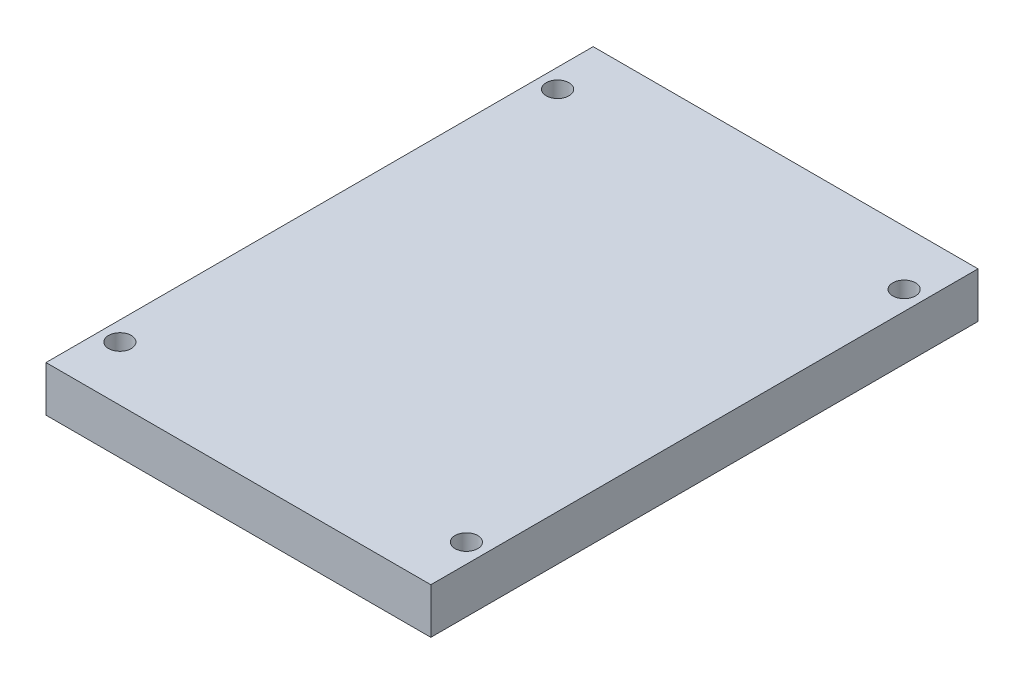
from build123d import *

# Parameters (mm, degrees)
SKETCH1_W           = 54.61
SKETCH1_H           = 76.2
BOSS_EXTRUDE1_DEPTH = 6.35
SKETCH2_R           = 1.5875
CUT_EXTRUDE1_DEPTH  = 94.962836271
SKETCH3_W           = 0.508
SKETCH3_H           = 76.2
CUT_EXTRUDE2_DEPTH  = 94.962836271


with BuildPart() as part:
    # Sketch1 → Boss-Extrude1 (new body)
    with BuildSketch(Plane(origin=(0, 0, 0), x_dir=(1, 0, 0), z_dir=(0, 1, 0))):
        with Locations((-27.305, 38.1)):
            Rectangle(SKETCH1_W, SKETCH1_H)
    extrude(amount=BOSS_EXTRUDE1_DEPTH)

    # Sketch2 → Cut-Extrude1 (cut, through all)
    with BuildSketch(Plane(origin=(0, 6.35, 0), x_dir=(1, 0, 0), z_dir=(0, 1, 0))):
        with Locations((-3.175, 7.62)):
            Circle(SKETCH2_R)
        with Locations((-3.175, 68.58)):
            Circle(SKETCH2_R)
    cut_extrude1 = extrude(amount=-CUT_EXTRUDE1_DEPTH, mode=Mode.SUBTRACT)

    # Mirror1: Cut-Extrude1 across plane
    add(cut_extrude1.mirror(Plane(origin=(-27.305, 0, 0), x_dir=(0, 0, 1), z_dir=(1, 0, 0))), mode=Mode.SUBTRACT)

    # Sketch3 → Cut-Extrude2 (cut, through all)
    with BuildSketch(Plane(origin=(0, 6.35, 0), x_dir=(1, 0, 0), z_dir=(0, 1, 0))):
        with Locations((-0.254, 38.1)):
            Rectangle(SKETCH3_W, SKETCH3_H)
    cut_extrude2 = extrude(amount=-CUT_EXTRUDE2_DEPTH, mode=Mode.SUBTRACT)

    # Mirror2: Cut-Extrude2 across plane
    add(cut_extrude2.mirror(Plane(origin=(-27.305, 0, 0), x_dir=(0, 0, 1), z_dir=(1, 0, 0))), mode=Mode.SUBTRACT)


solid = part.part
